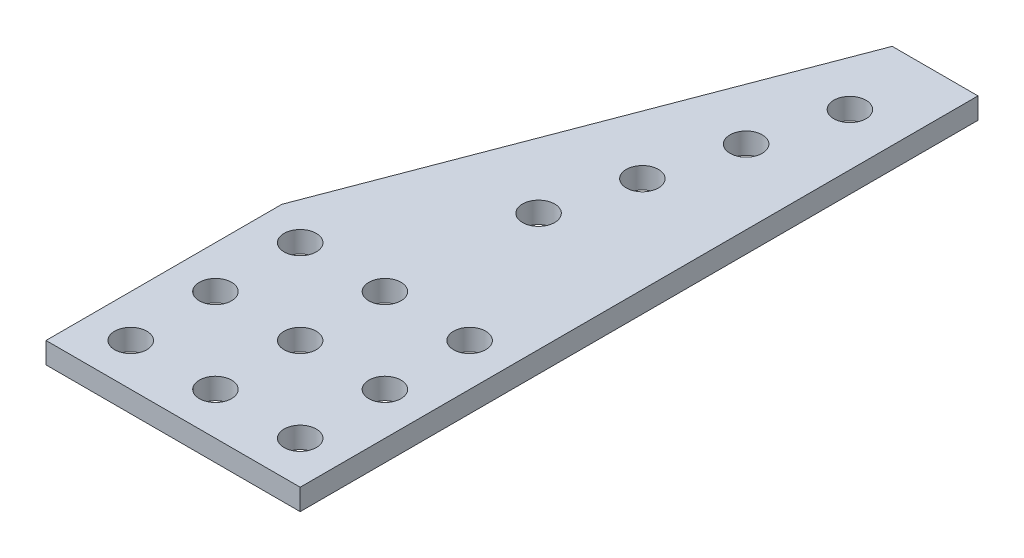
from build123d import *

# Parameters (mm, degrees)
SKETCH1_W           = 38.1
SKETCH1_H           = 101.6
BOSS_EXTRUDE1_DEPTH = 3.175
SKETCH2_R           = 2.413
CUT_EXTRUDE1_DEPTH  = 109.555288333
CUT_EXTRUDE3_DEPTH  = 109.555288333
SKETCH3_R           = 2.413
CUT_EXTRUDE2_DEPTH  = 109.555288333


with BuildPart() as part:
    # Sketch1 → Boss-Extrude1 (new body)
    with BuildSketch(Plane(origin=(0, 0, 0), x_dir=(1, 0, 0), z_dir=(0, 1, 0))):
        with Locations((19.05, 50.8)):
            Rectangle(SKETCH1_W, SKETCH1_H)
    extrude(amount=BOSS_EXTRUDE1_DEPTH)

    # Sketch2 → Cut-Extrude1 (cut, through all)
    with BuildSketch(Plane(origin=(0, 3.175, 0), x_dir=(1, 0, 0), z_dir=(0, 1, 0))):
        with Locations((6.35, 6.35)):
            Circle(SKETCH2_R)
        with Locations((19.05, 6.35)):
            Circle(SKETCH2_R)
        with Locations((31.75, 6.35)):
            Circle(SKETCH2_R)
        with Locations((6.35, 19.05)):
            Circle(SKETCH2_R)
        with Locations((19.05, 19.05)):
            Circle(SKETCH2_R)
        with Locations((31.75, 19.05)):
            Circle(SKETCH2_R)
        with Locations((6.35, 31.75)):
            Circle(SKETCH2_R)
        with Locations((19.05, 31.75)):
            Circle(SKETCH2_R)
        with Locations((31.75, 31.75)):
            Circle(SKETCH2_R)
    extrude(amount=-CUT_EXTRUDE1_DEPTH, mode=Mode.SUBTRACT)

    # Sketch4 → Cut-Extrude3 (cut, through all)
    with BuildSketch(Plane(origin=(0, 3.175, 0), x_dir=(1, 0, 0), z_dir=(0, 1, 0))):
        Polygon((25.239755938, 101.6), (0, 35.356248655), (0, 101.6), align=None)
    extrude(amount=-CUT_EXTRUDE3_DEPTH, mode=Mode.SUBTRACT)

    # Sketch3 → Cut-Extrude2 (cut, through all)
    with BuildSketch(Plane(origin=(0, 3.175, 0), x_dir=(1, 0, 0), z_dir=(0, 1, 0))):
        with Locations((30.266233828, 90.232030103)):
            Circle(SKETCH3_R)
        with Locations((26.979231955, 77.964772109)):
            Circle(SKETCH3_R)
        with Locations((23.692230082, 65.697514115)):
            Circle(SKETCH3_R)
        with Locations((20.40522821, 53.430256121)):
            Circle(SKETCH3_R)
    extrude(amount=-CUT_EXTRUDE2_DEPTH, mode=Mode.SUBTRACT)


solid = part.part
